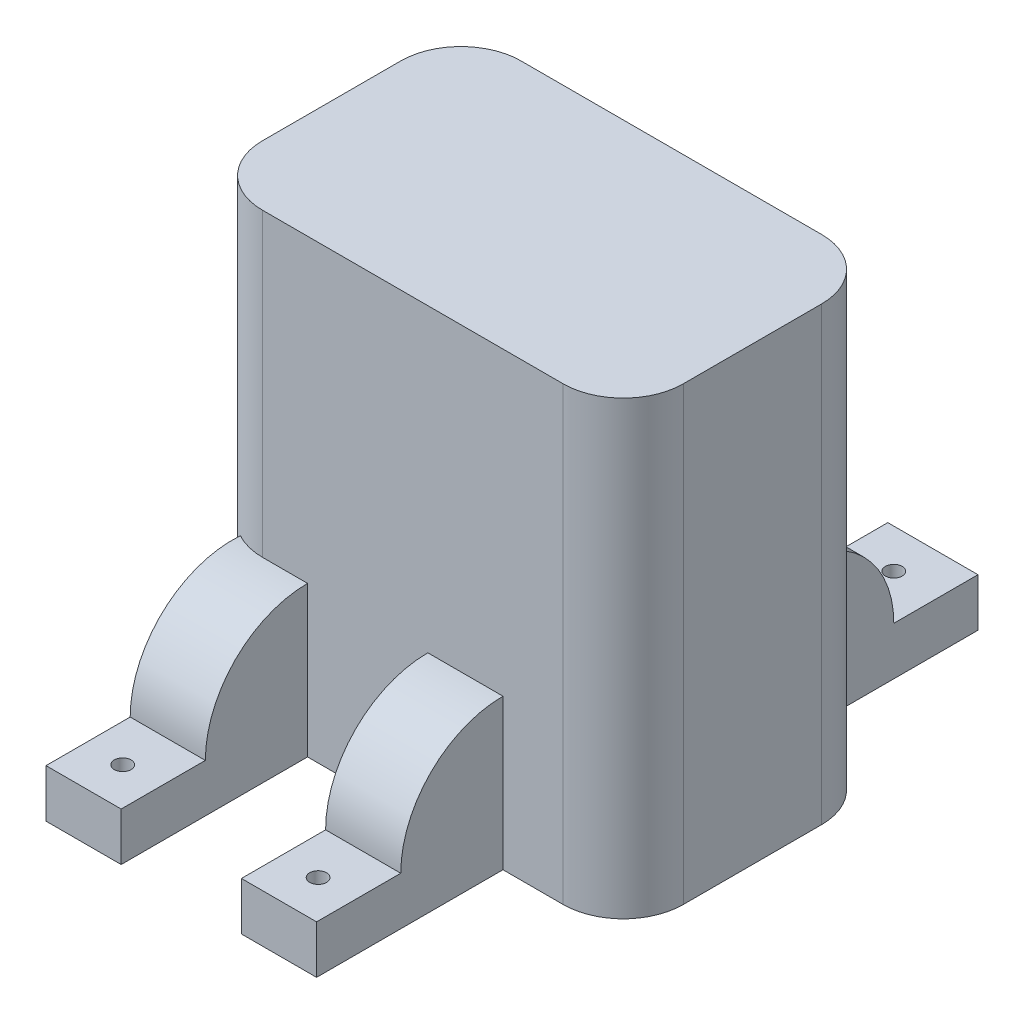
from build123d import *

# Parameters (mm, degrees)
ESQUISSE1_W             = 7
ESQUISSE1_H             = 4.3
BOSS_EXTRU_1_DEPTH      = 7.5
COQUE1_T                = -1
ESQUISSE2_W             = 1.25
ESQUISSE2_H             = 0.8
BOSS_EXTRU_2_DEPTH      = 3.1
ESQUISSE3_W             = 1.5
ESQUISSE3_H             = 0.8
BOSS_EXTRU_3_DEPTH      = 3.1
ESQUISSE4_R             = 0.14
ENL_V_MAT_EXTRU_1_DEPTH = 13.192210628
BOSS_EXTRU_4_DEPTH      = 1.25
BOSS_EXTRU_5_START      = -1.25
BOSS_EXTRU_5_DEPTH      = 1.25
BOSS_EXTRU_6_DEPTH      = 1.5
CONG_1_R                = 1


with BuildPart() as part:
    # Esquisse1 → Boss.-Extru.1 (new body)
    with BuildSketch(Plane(origin=(0, 0, 0), x_dir=(1, 0, 0), z_dir=(0, 1, 0))):
        with Locations((3.5, 2.15)):
            Rectangle(ESQUISSE1_W, ESQUISSE1_H)
    extrude(amount=BOSS_EXTRU_1_DEPTH)

    # Coque1
    coque1_openings = [part.faces().sort_by_distance(p)[0] for p in [
        (3.5, 0, -2.15),
    ]]
    offset(amount=COQUE1_T, openings=coque1_openings, kind=Kind.INTERSECTION)

    # Esquisse2 → Boss.-Extru.2 (add)
    with BuildSketch(Plane.XY):
        with Locations((1.125, 0.4)):
            Rectangle(ESQUISSE2_W, ESQUISSE2_H)
        with Locations((4.375, 0.4)):
            Rectangle(ESQUISSE2_W, ESQUISSE2_H)
    extrude(amount=BOSS_EXTRU_2_DEPTH)

    # Esquisse3 → Boss.-Extru.3 (add)
    with BuildSketch(Plane(origin=(0, 0, -4.3), x_dir=(-1, 0, 0), z_dir=(0, 0, -1))):
        with Locations((-4.75, 0.4)):
            Rectangle(ESQUISSE3_W, ESQUISSE3_H)
    extrude(amount=BOSS_EXTRU_3_DEPTH)

    # Esquisse4 → Enlèv. mat.-Extru.1 (cut, through all)
    with BuildSketch(Plane(origin=(0, 0.8, 0), x_dir=(1, 0, 0), z_dir=(0, 1, 0))):
        with Locations(Location((4.75, 6.75, 0), (0, 0, 270))):
            Circle(ESQUISSE4_R)
        with Locations(Location((1.125, -2.45, 0), (0, 0, 270))):
            Circle(ESQUISSE4_R)
        with Locations(Location((4.375, -2.45, 0), (0, 0, 270))):
            Circle(ESQUISSE4_R)
    extrude(amount=-ENL_V_MAT_EXTRU_1_DEPTH, mode=Mode.SUBTRACT)

    # Esquisse5 → Boss.-Extru.4 (add)
    with BuildSketch(Plane(origin=(5, 0, 0), x_dir=(0, 0, -1), z_dir=(1, 0, 0))):
        with BuildLine():
            Line((0, 2.5), (0, 0.8))
            Line((0, 0.8), (-1.7, 0.8))
            ThreePointArc((-1.7, 0.8), (-1.202081528, 2.002081528), (0, 2.5))
        make_face()
    extrude(amount=-BOSS_EXTRU_4_DEPTH)

    # Esquisse6 → Boss.-Extru.5 (add)
    with BuildSketch(Plane.ZY.offset(-0.5).offset(BOSS_EXTRU_5_START)):
        with BuildLine():
            Line((0, 2.5), (0, 0.8))
            Line((0, 0.8), (1.7, 0.8))
            ThreePointArc((1.7, 0.8), (1.202081528, 2.002081528), (0, 2.5))
        make_face()
    extrude(amount=BOSS_EXTRU_5_DEPTH)

    # Esquisse7 → Boss.-Extru.6 (add)
    with BuildSketch(Plane.ZY.offset(-4)):
        with BuildLine():
            Line((-4.3, 2.5), (-4.3, 0.8))
            Line((-4.3, 0.8), (-6, 0.8))
            ThreePointArc((-6, 0.8), (-5.502081528, 2.002081528), (-4.3, 2.5))
        make_face()
    extrude(amount=-BOSS_EXTRU_6_DEPTH)

    # Congé1
    # the kernel refuses this fillet: 1 mm, written as the material it takes off along each edge
    with BuildSketch(Plane(origin=(0, -2.5, 0), x_dir=(1, 0, 0), z_dir=(0, 1, 0))) as cong_1_piece_1_section:
        with BuildLine():
            CenterArc((CONG_1_R, CONG_1_R), CONG_1_R, 180, 90)
            Line((0, CONG_1_R), (0, 0))
            Line((0, 0), (CONG_1_R, 0))
        make_face()
    cong_1_piece_1 = extrude(amount=12.5, mode=Mode.PRIVATE)
    cong_1_piece_1 = split(cong_1_piece_1, bisect_by=Plane(origin=(0.5, 1.236097217, -0.241175313), z_dir=(-1, 0, 0)), keep=Keep.TOP, mode=Mode.PRIVATE)
    add(cong_1_piece_1, mode=Mode.SUBTRACT)
    with BuildSketch(Plane(origin=(0, -2.5, 0), x_dir=(1, 0, 0), z_dir=(0, 1, 0))) as cong_1_piece_2_section:
        with BuildLine():
            CenterArc((CONG_1_R, CONG_1_R), CONG_1_R, 180, 90)
            Line((0, CONG_1_R), (0, 0))
            Line((0, 0), (CONG_1_R, 0))
        make_face()
    cong_1_piece_2 = extrude(amount=12.5, mode=Mode.PRIVATE)
    cong_1_piece_2 = cong_1_piece_2 - Plane(origin=(0.623254318, 0.8, 0), x_dir=(0, 0, 1), z_dir=(1, 0, 0)) * Cylinder(1.7, 29, mode=Mode.PRIVATE)
    add(cong_1_piece_2, mode=Mode.SUBTRACT)
    with BuildSketch(Plane(origin=(0, -2.5, -4.3), x_dir=(1, 0, 0), z_dir=(0, 1, 0)), Plane(origin=(7, -2.5, -4.3), x_dir=(0, 0, 1), z_dir=(0, 1, 0)), Plane(origin=(7, -2.5, 0), x_dir=(-1, 0, 0), z_dir=(0, 1, 0))) as cong_1_piece_3:
        with BuildLine():
            CenterArc((CONG_1_R, -CONG_1_R), CONG_1_R, 90, 90)
            Line((0, -CONG_1_R), (0, 0))
            Line((0, 0), (CONG_1_R, 0))
        make_face()
    extrude(amount=12.5, mode=Mode.SUBTRACT)


solid = part.part
